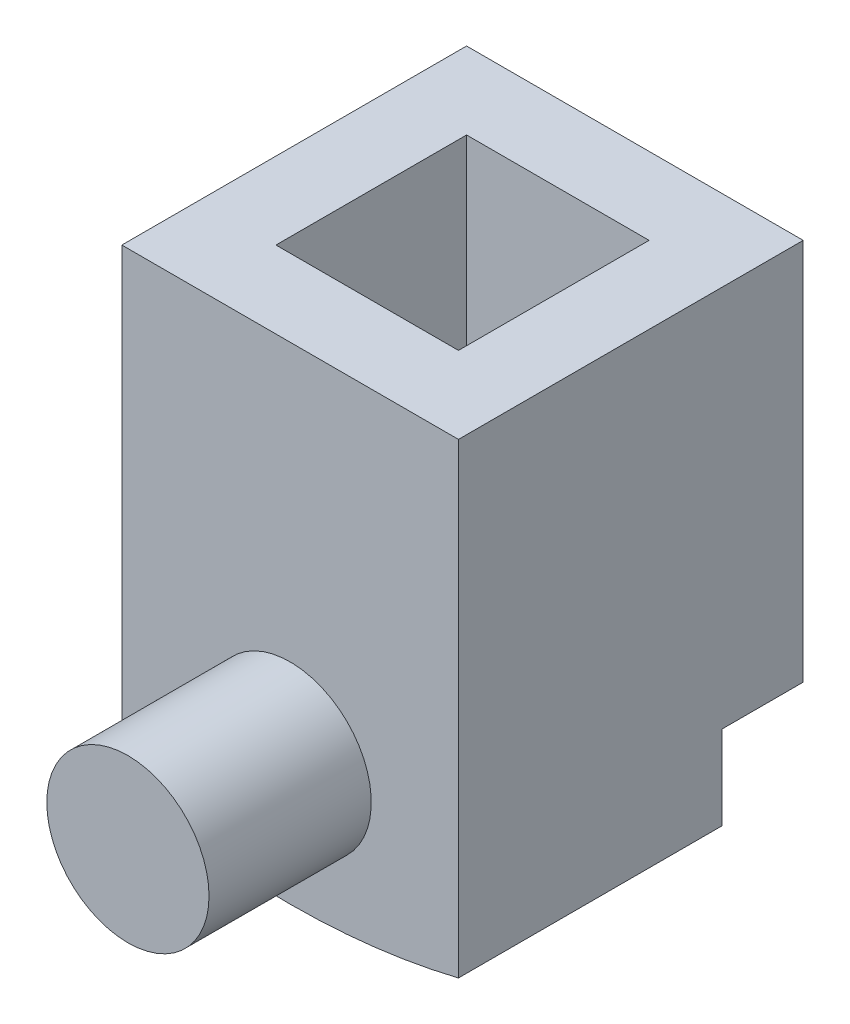
from build123d import *

# Parameters (mm, degrees)
CROQUIS1_W              = 8.3
CROQUIS1_H              = 8.5
CROQUIS1_W_2            = 4.5
CROQUIS1_H_2            = 4.7
SALIENTE_EXTRUIR1_DEPTH = 12
CORTAR_EXTRUIR3_START   = -8.5
CORTAR_EXTRUIR3_DEPTH   = 8.5
CROQUIS3_R              = 2
SALIENTE_EXTRUIR2_DEPTH = 4
CORTAR_EXTRUIR4_START   = -2
CORTAR_EXTRUIR4_DEPTH   = 2


# Read off the part's stored shape, not the designer's step: Cortar-Extruir3
with BuildPart() as part:
    # Croquis1 → Saliente-Extruir1 (new body)
    with BuildSketch(Plane(origin=(0, 0, 0), x_dir=(1, 0, 0), z_dir=(0, 1, 0))):
        Rectangle(CROQUIS1_W, CROQUIS1_H)
        Rectangle(CROQUIS1_W_2, CROQUIS1_H_2, mode=Mode.SUBTRACT)
    extrude(amount=SALIENTE_EXTRUIR1_DEPTH)

    # Cortar-Extruir3 outline → Cortar-Extruir3 (cut)
    with BuildSketch(Plane(origin=(0, 0, -4.25), x_dir=(-1, 0, 0), z_dir=(0, 0, -1)).offset(CORTAR_EXTRUIR3_START)):
        with BuildLine():
            Line((0, 0), (4.15, 0))
            Line((4.15, 0), (4.15, 0.499191196))
            ThreePointArc((4.15, 0.499191196), (2.089957646, 0.125245986), (0, 0))
        make_face()
        with BuildLine():
            Line((-4.15, 0.499191196), (-4.15, 0))
            Line((-4.15, 0), (0, 0))
            ThreePointArc((0, 0), (-2.089957646, 0.125245986), (-4.15, 0.499191196))
        make_face()
    extrude(amount=CORTAR_EXTRUIR3_DEPTH, mode=Mode.SUBTRACT)

    # Croquis3 → Saliente-Extruir2 (add)
    with BuildSketch(Plane.XY.offset(4.25)):
        with Locations(Location((0, 3.175, 0), (0, 0, 180))):
            Circle(CROQUIS3_R)
    extrude(amount=SALIENTE_EXTRUIR2_DEPTH)

    # Croquis4 → Cortar-Extruir4 (cut)
    with BuildSketch(Plane(origin=(0, 0, -4.25), x_dir=(-1, 0, 0), z_dir=(0, 0, -1)).offset(CORTAR_EXTRUIR4_START)):
        with BuildLine():
            Line((-4.15, 2.565894737), (-4.15, 0.499191196))
            ThreePointArc((-4.15, 0.499191196), (0, 0), (4.15, 0.499191196))
            Line((4.15, 0.499191196), (4.15, 2.565894737))
            ThreePointArc((4.15, 2.565894737), (0, 2), (-4.15, 2.565894737))
        make_face()
    extrude(amount=CORTAR_EXTRUIR4_DEPTH, mode=Mode.SUBTRACT)


solid = part.part
